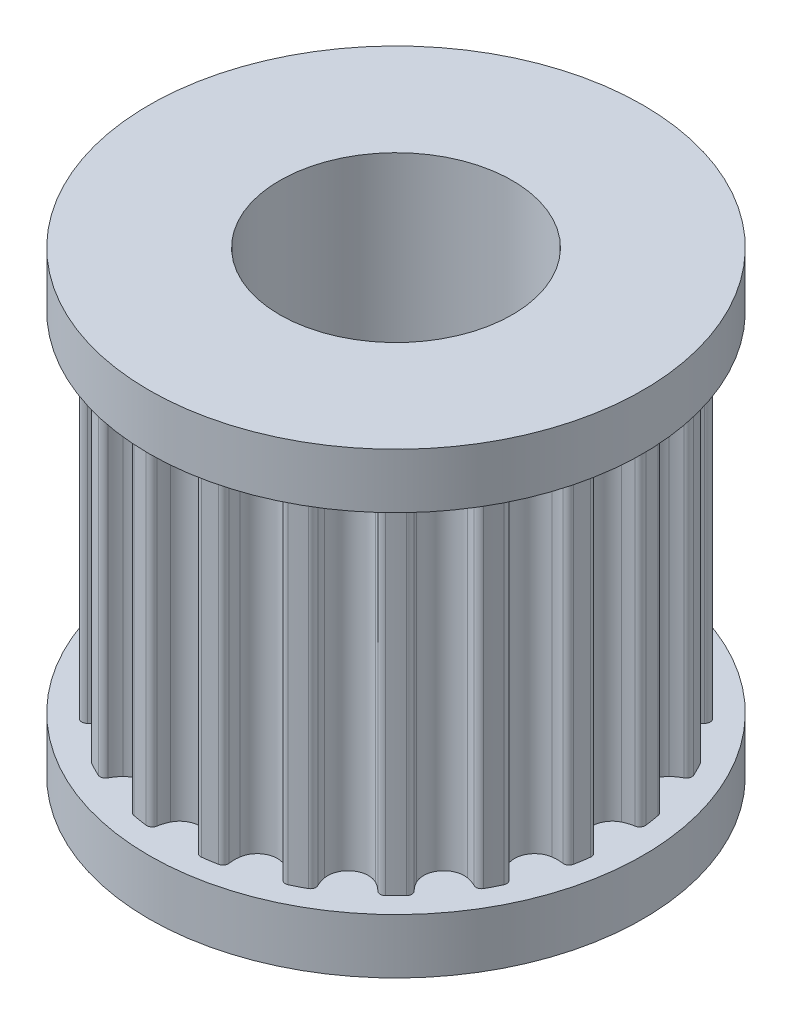
from build123d import *

# Parameters (mm, degrees)
GT2_SKETCH_R                        = 6.112197724
GT2_SKETCH_R_2                      = 3.175
PULLEY_BODY_DEPTH                   = 9.5
TOOTH_EXTRUDE_DEPTH                 = 13.843983885
TOOTH_PATTERN_COUNT                 = 20
BOTTOM_START                        = -1.5
GT2_SKETCH_4_R                      = 6.742197724
GT2_SKETCH_4_R_2                    = 3.175
BOTTOM_RETAINER_BOSS_EXTRUDE2_DEPTH = 1.5
TOP_START                           = 9.5
GT2_SKETCH_5_R                      = 6.742197724
GT2_SKETCH_5_R_2                    = 3.175
TOP_RETAINER_BOSS_EXTRUDE3_DEPTH    = 1.5


with BuildPart() as part:
    # GT2 Sketch → Pulley Body (new body)
    with BuildSketch(Plane(origin=(0, 0, 0), x_dir=(1, 0, 0), z_dir=(0, 1, 0))):
        Circle(GT2_SKETCH_R)
        Circle(GT2_SKETCH_R_2, mode=Mode.SUBTRACT)
    extrude(amount=PULLEY_BODY_DEPTH)

    # GT2 Sketch<3> → Tooth Extrude (cut, through all)
    with BuildSketch(Plane(origin=(0, 0, 0), x_dir=(1, 0, 0), z_dir=(0, 1, 0))):
        with BuildLine():
            ThreePointArc((0.587337411, 5.94046081), (0.645388727, 6.036628679), (0.753940546, 6.065520148))
            ThreePointArc((0.753940546, 6.065520148), (0, 6.112197724), (-0.753940546, 6.065520148))
            ThreePointArc((-0.753940546, 6.065520148), (-0.645388727, 6.036628679), (-0.587337411, 5.94046081))
            ThreePointArc((-0.587337411, 5.94046081), (-0.553409776, 5.797416793), (-0.498876404, 5.660892851))
            ThreePointArc((-0.498876404, 5.660892851), (0, 5.349095098), (0.498876404, 5.660892851))
            ThreePointArc((0.498876404, 5.660892851), (0.553409776, 5.797416793), (0.587337411, 5.94046081))
        make_face()
    tooth_extrude = extrude(amount=TOOTH_EXTRUDE_DEPTH, mode=Mode.SUBTRACT)

    # Tooth Pattern: Tooth Extrude ×20 about axis
    tooth_pattern_axis = Axis((0, -105.04218919, 0), (0, 1, 0))
    for i in range(1, TOOTH_PATTERN_COUNT):
        add(tooth_extrude.rotate(tooth_pattern_axis, i * 360 / TOOTH_PATTERN_COUNT), mode=Mode.SUBTRACT)

    # GT2 Sketch<4> → Bottom Retainer Boss-Extrude2 (add)
    with BuildSketch(Plane(origin=(0, 0, 0), x_dir=(1, 0, 0), z_dir=(0, 1, 0)).offset(BOTTOM_START)):
        Circle(GT2_SKETCH_4_R)
        Circle(GT2_SKETCH_4_R_2, mode=Mode.SUBTRACT)
    extrude(amount=BOTTOM_RETAINER_BOSS_EXTRUDE2_DEPTH)

    # GT2 Sketch<5> → Top Retainer Boss-Extrude3 (add)
    with BuildSketch(Plane(origin=(0, 0, 0), x_dir=(1, 0, 0), z_dir=(0, 1, 0)).offset(TOP_START)):
        Circle(GT2_SKETCH_5_R)
        Circle(GT2_SKETCH_5_R_2, mode=Mode.SUBTRACT)
    extrude(amount=TOP_RETAINER_BOSS_EXTRUDE3_DEPTH)


solid = part.part
